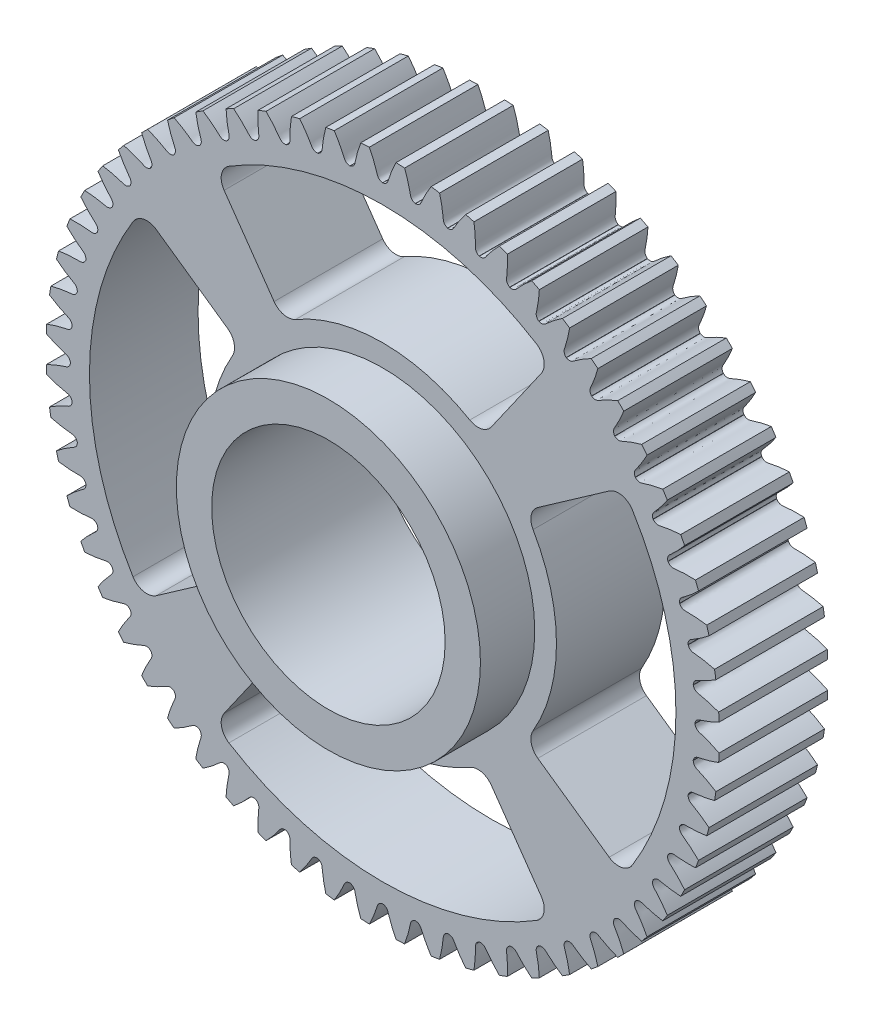
from build123d import *

# Parameters (mm, degrees)
SKETCH_1_R               = 31
EXTRUDE_1_DEPTH          = 10
CUT_EXTRUDE_1_DEPTH      = 45.966654312
PATTERN_CIRCULAR_1_COUNT = 60
SKETCH_4_R               = 10.75
CUT_EXTRUDE_3_DEPTH      = 45.932991754
EXTRUDE_START            = 5
SKETCH_5_R               = 14
SKETCH_5_R_2             = 10.75
EXTRUDE_3_DEPTH          = 5


with BuildPart() as part:
    # 草图1 → 凸台-拉伸1 (new body)
    with BuildSketch(Plane.XY):
        Circle(SKETCH_1_R)
    extrude(amount=EXTRUDE_1_DEPTH)

    # 草图2 → 切除-拉伸1 (cut, through all)
    with BuildSketch(Plane.XY):
        with BuildLine():
            ThreePointArc((0.01, 28.749955146), (0, 28.749956885), (-0.01, 28.749955146))
            add(Edge.make_bspline(
                [(-0.01, 28.749955146), (-0.429486861, 28.819346682), (-0.495837594, 29.165510951), (-0.623870472, 29.550234202), (-0.684032437, 29.723155344), (-0.751857968, 29.905235087), (-0.827366852, 30.09646236), (-0.911058345, 30.296531075), (-1.003283142, 30.505205894), (-1.104426215, 30.722215721), (-1.214853301, 30.947284868), (-1.334925974, 31.18012428), (-1.464996911, 31.420434309), (-1.605410859, 31.667904179), (-1.756503978, 31.922212404), (-1.918603646, 32.183026949), (-2.092028155, 32.450005472), (-2.277086427, 32.722795549), (-2.474077745, 33.001034914), (-2.683291482, 33.284351708), (-2.905006832, 33.57236473), (-3.139492582, 33.864683697), (-3.387006745, 34.160909512), (-3.739661599, 34.566214433), (-4.017144851, 34.866196888), (-4.208552041, 35.065218488)],
                knots=[0, 0, 0, 0, 0.112555337, 0.134959594, 0.158834787, 0.184180916, 0.210997981, 0.239285981, 0.269044917, 0.300274789, 0.332975596, 0.367147339, 0.402790018, 0.439903633, 0.478488184, 0.51854367, 0.560070092, 0.60306745, 0.647535744, 0.693474973, 0.740885138, 0.789766239, 0.840118276, 0.891941248, 1, 1, 1, 1], degree=3))
            ThreePointArc((-4.208552041, 35.065218488), (0, 35.316872142), (4.208552041, 35.065218488))
            add(Edge.make_bspline(
                [(0.01, 28.749955146), (0.429486861, 28.819346682), (0.495837594, 29.165510951), (0.623870472, 29.550234202), (0.684032437, 29.723155344), (0.751857968, 29.905235087), (0.827366852, 30.09646236), (0.911058345, 30.296531075), (1.003283142, 30.505205894), (1.104426215, 30.722215721), (1.214853301, 30.947284868), (1.334925974, 31.18012428), (1.464996911, 31.420434309), (1.605410859, 31.667904179), (1.756503978, 31.922212404), (1.918603646, 32.183026949), (2.092028155, 32.450005472), (2.277086427, 32.722795549), (2.474077745, 33.001034914), (2.683291482, 33.284351708), (2.905006832, 33.57236473), (3.139492582, 33.864683697), (3.387006745, 34.160909512), (3.739661599, 34.566214433), (4.017144851, 34.866196888), (4.208552041, 35.065218488)],
                knots=[0, 0, 0, 0, 0.112555337, 0.134959594, 0.158834787, 0.184180916, 0.210997981, 0.239285981, 0.269044917, 0.300274789, 0.332975596, 0.367147339, 0.402790018, 0.439903633, 0.478488184, 0.51854367, 0.560070092, 0.60306745, 0.647535744, 0.693474973, 0.740885138, 0.789766239, 0.840118276, 0.891941248, 1, 1, 1, 1], degree=3))
        make_face()
    cut_extrude_1 = extrude(amount=CUT_EXTRUDE_1_DEPTH, mode=Mode.SUBTRACT)

    # 阵列(圆周)1: 切除-拉伸1 ×60 about axis
    pattern_circular_1_axis = Axis((0, 0, -1.5), (0, 0, 1))
    for i in range(1, PATTERN_CIRCULAR_1_COUNT):
        add(cut_extrude_1.rotate(pattern_circular_1_axis, i * 360 / PATTERN_CIRCULAR_1_COUNT), mode=Mode.SUBTRACT)

    # 草图4 → 切除-拉伸3 (cut, through all)
    with BuildSketch(Plane.XY.offset(10)):
        with BuildLine():
            Line((-14.600872356, 20.852206752), (-10.00064689, 14.282403922))
            ThreePointArc((-10.00064689, 14.282403922), (-9.095518728, 13.678090079), (-8.020040067, 13.844816984))
            ThreePointArc((-8.020040067, 13.844816984), (0, 16), (8.020040067, 13.844816984))
            ThreePointArc((8.020040067, 13.844816984), (9.095518728, 13.678090079), (10.00064689, 14.282403922))
            Line((10.00064689, 14.282403922), (14.600872356, 20.852206752))
            ThreePointArc((14.600872356, 20.852206752), (14.841052027, 22.016397112), (14.158741013, 22.98978149))
            ThreePointArc((14.158741013, 22.98978149), (0, 27), (-14.158741013, 22.98978149))
            ThreePointArc((-14.158741013, 22.98978149), (-14.841052027, 22.016397112), (-14.600872356, 20.852206752))
        make_face()
        with BuildLine():
            ThreePointArc((13.844816984, -8.020040067), (13.678090079, -9.095518728), (14.282403922, -10.00064689))
            Line((14.282403922, -10.00064689), (20.852206752, -14.600872356))
            ThreePointArc((20.852206752, -14.600872356), (22.016397112, -14.841052027), (22.98978149, -14.158741013))
            ThreePointArc((22.98978149, -14.158741013), (27, 0), (22.98978149, 14.158741013))
            ThreePointArc((22.98978149, 14.158741013), (22.016397112, 14.841052027), (20.852206752, 14.600872356))
            Line((20.852206752, 14.600872356), (14.282403922, 10.00064689))
            ThreePointArc((14.282403922, 10.00064689), (13.678090079, 9.095518728), (13.844816984, 8.020040067))
            ThreePointArc((13.844816984, 8.020040067), (16, 0), (13.844816984, -8.020040067))
        make_face()
        with BuildLine():
            ThreePointArc((-8.020040067, -13.844816984), (-9.095518728, -13.678090079), (-10.00064689, -14.282403922))
            Line((-10.00064689, -14.282403922), (-14.600872356, -20.852206752))
            ThreePointArc((-14.600872356, -20.852206752), (-14.841052027, -22.016397112), (-14.158741013, -22.98978149))
            ThreePointArc((-14.158741013, -22.98978149), (0, -27), (14.158741013, -22.98978149))
            ThreePointArc((14.158741013, -22.98978149), (14.841052027, -22.016397112), (14.600872356, -20.852206752))
            Line((14.600872356, -20.852206752), (10.00064689, -14.282403922))
            ThreePointArc((10.00064689, -14.282403922), (9.095518728, -13.678090079), (8.020040067, -13.844816984))
            ThreePointArc((8.020040067, -13.844816984), (0, -16), (-8.020040067, -13.844816984))
        make_face()
        with BuildLine():
            ThreePointArc((-13.844816984, 8.020040067), (-13.678090079, 9.095518728), (-14.282403922, 10.00064689))
            Line((-14.282403922, 10.00064689), (-20.852206752, 14.600872356))
            ThreePointArc((-20.852206752, 14.600872356), (-22.016397112, 14.841052027), (-22.98978149, 14.158741013))
            ThreePointArc((-22.98978149, 14.158741013), (-27, 0), (-22.98978149, -14.158741013))
            ThreePointArc((-22.98978149, -14.158741013), (-22.016397112, -14.841052027), (-20.852206752, -14.600872356))
            Line((-20.852206752, -14.600872356), (-14.282403922, -10.00064689))
            ThreePointArc((-14.282403922, -10.00064689), (-13.678090079, -9.095518728), (-13.844816984, -8.020040067))
            ThreePointArc((-13.844816984, -8.020040067), (-16, 0), (-13.844816984, 8.020040067))
        make_face()
        Circle(SKETCH_4_R)
    extrude(amount=-CUT_EXTRUDE_3_DEPTH, mode=Mode.SUBTRACT)

    # 草图5 → 凸台-拉伸3 (add)
    with BuildSketch(Plane.XY.offset(10).offset(EXTRUDE_START)):
        Circle(SKETCH_5_R)
        Circle(SKETCH_5_R_2, mode=Mode.SUBTRACT)
    extrude(amount=-EXTRUDE_3_DEPTH)


solid = part.part
